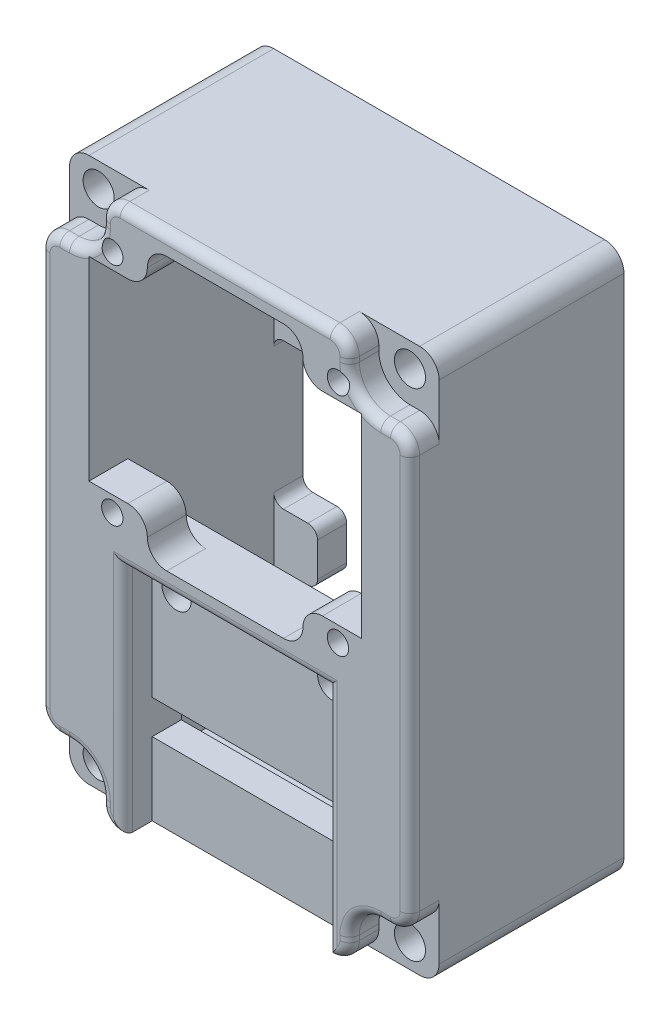
from build123d import *

# Parameters (mm, degrees)
EXTRUDE_1_DEPTH      = 22
SKETCH_2_W           = 28
SKETCH_2_H           = 20
CUT_EXTRUDE_1_DEPTH  = 50.44694126030446
CUT_EXTRUDE_4_DEPTH  = 3
CUT_EXTRUDE_5_DEPTH  = 49.187135212627034
SKETCH_7_W           = 28
SKETCH_7_H           = 28
CUT_EXTRUDE_6_DEPTH  = 18
SKETCH_8_R           = 1.6000000000000019
SKETCH_8_R_2         = 1.5999999999999974
SKETCH_8_R_3         = 1.6000000000000079
CUT_EXTRUDE_7_DEPTH  = 50.44694126030446
SKETCH_9_R           = 1.100000000000001
CUT_EXTRUDE_8_DEPTH  = 48.80167361086848
SKETCH_10_W          = 16
SKETCH_10_H          = 28
CUT_EXTRUDE_9_DEPTH  = 50.44694126030446
SKETCH_11_R          = 1.5
SKETCH_11_R_2        = 1.4999999999999991
CUT_EXTRUDE_10_DEPTH = 49.187135212627034
FILLET_1_R           = 2
FILLET_2_R           = 2
SKETCH_12_W          = 28.000000000000004
SKETCH_12_H          = 24
CUT_EXTRUDE_11_DEPTH = 16
SKETCH_13_W          = 21.000000000000018
SKETCH_13_H          = 8.455815676283699
CUT_EXTRUDE_12_DEPTH = 3
CUT_EXTRUDE_13_REACH = 65.095
CUT_EXTRUDE_14_DEPTH = 3
FILLET_4_R           = 2
FILLET_5_R           = 1
SKETCH_16_W          = 4.5
SKETCH_16_H          = 30
EXTRUDE_2_DEPTH      = 3
SKETCH_17_W          = 28.000000000000007
SKETCH_17_H          = 15
CUT_EXTRUDE_15_DEPTH = 3
FILLET_6_R           = 1


# Some blends are built 0.0001 mm under size
with BuildPart() as part:
    # 草图1 → 凸台-拉伸1 (new body)
    with BuildSketch(Plane.XY):
        Polygon((-19, 15.999999999999996), (19, 15.999999999999996), (19.000000000000007, -40), (-18.999999999999993, -40), align=None)
    extrude(amount=EXTRUDE_1_DEPTH)

    # 草图2 → 切除-拉伸1 (cut, through all)
    with BuildSketch(Plane.XY.offset(22)):
        Rectangle(SKETCH_2_W, SKETCH_2_H)
    extrude(amount=-CUT_EXTRUDE_1_DEPTH, mode=Mode.SUBTRACT)

    # 草图5 → 切除-拉伸4 (cut)
    with BuildSketch(Plane.XY.offset(22)):
        Polygon((-10.499999999999996, -16), (10.500000000000004, -16), (10.500000000000007, -32), (-10.499999999999995, -32), align=None)
    extrude(amount=-CUT_EXTRUDE_4_DEPTH, mode=Mode.SUBTRACT)

    # 草图6 → 切除-拉伸5 (cut, through all)
    with BuildSketch(Plane.XY.offset(19)):
        Polygon((-10.500000000000005, -28.999999999999996), (10.500000000000005, -28.999999999999996), (10.500000000000007, -32.5), (-10.500000000000005, -32.5), align=None)
    extrude(amount=-CUT_EXTRUDE_5_DEPTH, mode=Mode.SUBTRACT)

    # 草图7 → 切除-拉伸6 (cut)
    with BuildSketch(Plane(origin=(0, 0, 0), x_dir=(-1, 0, 0), z_dir=(0, 0, -1))):
        Rectangle(SKETCH_7_W, SKETCH_7_H)
    extrude(amount=-CUT_EXTRUDE_6_DEPTH, mode=Mode.SUBTRACT)

    # 草图8 → 切除-拉伸7 (cut, through all)
    with BuildSketch(Plane.XY.offset(22)):
        with Locations((-16.000000000000004, 13.499999999999996)):
            Circle(SKETCH_8_R)
        with Locations(Location((16.000000000000004, 13.5, 0), (0, 0, 180))):
            Circle(SKETCH_8_R)
        with Locations((16.000000000000004, -37.50000000000001)):
            Circle(SKETCH_8_R_2)
        with Locations(Location((-16.000000000000004, -37.5, 0), (0, 0, 180))):
            Circle(SKETCH_8_R_3)
    extrude(amount=-CUT_EXTRUDE_7_DEPTH, mode=Mode.SUBTRACT)

    # 草图9 → 切除-拉伸8 (cut, through all)
    with BuildSketch(Plane(origin=(0, 0, 18), x_dir=(-1, 0, 0), z_dir=(0, 0, -1))):
        with Locations((-11.6, 11.599999999999998)):
            Circle(SKETCH_9_R)
        with Locations((11.6, 11.600000000000001)):
            Circle(SKETCH_9_R)
        with Locations((11.6, -11.599999999999998)):
            Circle(SKETCH_9_R)
        with Locations((-11.6, -11.600000000000001)):
            Circle(SKETCH_9_R)
    extrude(amount=-CUT_EXTRUDE_8_DEPTH, mode=Mode.SUBTRACT)

    # 草图10 → 切除-拉伸9 (cut, through all)
    with BuildSketch(Plane.XY.offset(22)):
        Rectangle(SKETCH_10_W, SKETCH_10_H)
    extrude(amount=-CUT_EXTRUDE_9_DEPTH, mode=Mode.SUBTRACT)

    # 草图11 → 切除-拉伸10 (cut, through all)
    with BuildSketch(Plane.XY.offset(19)):
        with Locations((-7.999999999999998, -18.5)):
            Circle(SKETCH_11_R)
        with Locations(Location((8.000000000000002, -18.499999999999996, 0), (0, 0, 180))):
            Circle(SKETCH_11_R_2)
    extrude(amount=-CUT_EXTRUDE_10_DEPTH, mode=Mode.SUBTRACT)

    # 圆角1
    fillet_1_edges = [part.edges().sort_by_distance(p)[0] for p in [
        (-8, -14.000000000000002, 20),
        (8, -14.000000000000002, 20),
        (-8, 13.999999999999998, 20),
        (8, 13.999999999999998, 20),
    ]]
    fillet(fillet_1_edges, radius=FILLET_1_R)
    fillet_1_2_edges = [part.edges().sort_by_distance(p)[0] for p in [
        (-8, 10.000000000000002, 20),
        (8, 10.000000000000002, 20),
        (-8, -9.999999999999998, 20),
        (8, -9.999999999999998, 20),
    ]]
    fillet(fillet_1_2_edges, radius=FILLET_1_R - 0.0001)  # a hair under: the kernel refuses the full size

    # 圆角2
    fillet_2_edges = [part.edges().sort_by_distance(p)[0] for p in [
        (19.000000000000007, -40, 11),
        (-18.999999999999993, -40, 11),
        (-19, 15.999999999999996, 11),
        (19, 15.999999999999996, 11),
    ]]
    fillet(fillet_2_edges, radius=FILLET_2_R)

    # 草图12 → 切除-拉伸11 (cut)
    with BuildSketch(Plane(origin=(0, 0, 0), x_dir=(-1, 0, 0), z_dir=(0, 0, -1))):
        with Locations((0, -26)):
            Rectangle(SKETCH_12_W, SKETCH_12_H)
    extrude(amount=-CUT_EXTRUDE_11_DEPTH, mode=Mode.SUBTRACT)

    # 草图13 → 切除-拉伸12 (cut)
    with BuildSketch(Plane.XY.offset(22)):
        with Locations((0, -36.227907838141846)):
            Rectangle(SKETCH_13_W, SKETCH_13_H)
    extrude(amount=-CUT_EXTRUDE_12_DEPTH, mode=Mode.SUBTRACT)

    # 草图14 → 切除-拉伸13 (cut, up to next)
    with BuildSketch(Plane(origin=(0, -40, 0), x_dir=(-1, 0, 0), z_dir=(0, -1, 0)), mode=Mode.PRIVATE) as cut_extrude_13_sk1:
        Polygon((5.999999999999998, -3.9999999999999956), (-6.000000000000003, -4), (-6.000000000000002, 0), (5.999999999999998, 4e-16), align=None)
    cut_extrude_13_tool1 = extrude(cut_extrude_13_sk1.sketch, amount=-CUT_EXTRUDE_13_REACH, mode=Mode.PRIVATE) & part.part
    add(cut_extrude_13_tool1.solids().sort_by_distance((0, -40, 2))[0], mode=Mode.SUBTRACT)

    # 草图15 → 切除-拉伸14 (cut)
    with BuildSketch(Plane.XY.offset(22)):
        with BuildLine():
            Line((-12.8, 13.499999999999996), (-12.799999999999999, 15.999999999999996))
            Line((-12.799999999999999, 15.999999999999996), (-17.000000000000007, 15.999999999999996))
            ThreePointArc((-17.000000000000007, 15.999999999999996), (-18.414213562373103, 15.414213562373083), (-19, 13.999999999999982))
            Line((-19, 13.999999999999982), (-18.999999999999996, 10.299999999999969))
            Line((-18.999999999999996, 10.299999999999969), (-16.000000000000004, 10.29999999999998))
            ThreePointArc((-16.000000000000004, 10.29999999999998), (-13.737258300203038, 11.237258300203033), (-12.8, 13.499999999999996))
        make_face()
        with BuildLine():
            Line((12.8, 13.5), (12.799999999999999, 16))
            Line((12.799999999999999, 16), (17.000000000000014, 15.999999999999993))
            ThreePointArc((17.000000000000014, 15.999999999999993), (18.414213562373106, 15.414213562373082), (19.000000000000007, 13.99999999999998))
            Line((19.000000000000007, 13.99999999999998), (18.999999999999996, 10.299999999999974))
            Line((18.999999999999996, 10.299999999999974), (16.000000000000004, 10.299999999999983))
            ThreePointArc((16.000000000000004, 10.299999999999983), (13.737258300203047, 11.237258300203038), (12.8, 13.5))
        make_face()
        with BuildLine():
            Line((16.000000000000004, -34.29999999999996), (18.999999999999996, -34.299999999999955))
            Line((18.999999999999996, -34.299999999999955), (19.000000000000007, -37.999999999999964))
            ThreePointArc((19.000000000000007, -37.999999999999964), (18.414213562373106, -39.414213562373064), (17.000000000000014, -39.99999999999997))
            Line((17.000000000000014, -39.99999999999997), (12.799999999999999, -39.99999999999998))
            Line((12.799999999999999, -39.99999999999998), (12.8, -37.49999999999998))
            ThreePointArc((12.8, -37.49999999999998), (13.737258300203045, -35.23725830020302), (16.000000000000004, -34.29999999999996))
        make_face()
        with BuildLine():
            Line((-12.799999999999986, -37.49999999999998), (-12.799999999999985, -39.99999999999998))
            Line((-12.799999999999985, -39.99999999999998), (-17.000000000000007, -39.99999999999998))
            ThreePointArc((-17.000000000000007, -39.99999999999998), (-18.414213562373103, -39.414213562373064), (-19, -37.999999999999964))
            Line((-19, -37.999999999999964), (-18.999999999999982, -34.29999999999996))
            Line((-18.999999999999982, -34.29999999999996), (-15.99999999999999, -34.29999999999997))
            ThreePointArc((-15.99999999999999, -34.29999999999997), (-13.73725830020304, -35.237258300203024), (-12.799999999999986, -37.49999999999998))
        make_face()
    extrude(amount=-CUT_EXTRUDE_14_DEPTH, mode=Mode.SUBTRACT)

    # 圆角4
    fillet_4_edges = [part.edges().sort_by_distance(p)[0] for p in [
        (-12.799999999999985, -39.99999999999998, 20.5),
        (-18.999999999999982, -34.29999999999996, 20.5),
        (18.999999999999996, -34.299999999999955, 20.5),
        (12.799999999999999, -39.99999999999998, 20.5),
        (12.799999999999999, 16, 20.5),
        (18.999999999999996, 10.299999999999974, 20.5),
        (-18.999999999999996, 10.299999999999969, 20.5),
        (-12.799999999999999, 15.999999999999996, 20.5),
    ]]
    fillet(fillet_4_edges, radius=FILLET_4_R)

    # 圆角5
    # the kernel refuses this fillet: 1 mm, written as the material it takes off along each edge
    with BuildSketch(Plane(origin=(10.8, -38, 22), x_dir=(0, -1, 0), z_dir=(-1, 0, 0))) as fillet_5_piece_1:
        with BuildLine():
            CenterArc((2 - FILLET_5_R, -FILLET_5_R), FILLET_5_R, 0, 90)
            Line((2, -FILLET_5_R), (2, 0))
            Line((2, 0), (2 - FILLET_5_R, 0))
        make_face()
    revolve(axis=Axis((10.8, -38, 22), (0, 0, 1)), revolution_arc=90, mode=Mode.SUBTRACT)
    with BuildSketch(Plane(origin=(12.8, -38, 22), x_dir=(-1, 7.1e-16, 0), z_dir=(7.1e-16, 1, 0)), Plane(origin=(-12.799999999999986, -37.49999999999998, 22), x_dir=(1, 7.1e-16, 0), z_dir=(7.1e-16, -1, 0))) as fillet_5_piece_2:
        with BuildLine():
            CenterArc((FILLET_5_R, -FILLET_5_R), FILLET_5_R, 90, 90)
            Line((0, -FILLET_5_R), (0, 0))
            Line((0, 0), (FILLET_5_R, 0))
        make_face()
    extrude(amount=0.5000000000000213, mode=Mode.SUBTRACT)
    with BuildSketch(Plane(origin=(16.000000000000007, -37.49999999999997, 22), x_dir=(-1, -2.22e-15, 0), z_dir=(2.22e-15, -1, 0))) as fillet_5_piece_3:
        with BuildLine():
            CenterArc((3.200000000000008 + FILLET_5_R, FILLET_5_R), FILLET_5_R, 180, 90)
            Line((3.200000000000008, FILLET_5_R), (3.200000000000008, 0))
            Line((3.200000000000008, 0), (3.200000000000008 + FILLET_5_R, 0))
        make_face()
    revolve(axis=Axis((16.000000000000007, -37.49999999999997, 22), (0, 0, -1)), revolution_arc=90.00000000000006, mode=Mode.SUBTRACT)
    with BuildSketch(Plane(origin=(16.000000000000004, -34.29999999999996, 22), x_dir=(-2.37e-15, 1, 0), z_dir=(1, 2.37e-15, 0)), Plane(origin=(-16.999999999999996, -34.29999999999997, 22), x_dir=(2.37e-15, 1, 0), z_dir=(1, -2.37e-15, 0))) as fillet_5_piece_4:
        with BuildLine():
            CenterArc((FILLET_5_R, -FILLET_5_R), FILLET_5_R, 90, 90)
            Line((0, -FILLET_5_R), (0, 0))
            Line((0, 0), (FILLET_5_R, 0))
        make_face()
    extrude(amount=1.000000000000007, mode=Mode.SUBTRACT)
    with BuildSketch(Plane(origin=(17.000000000000007, -32.29999999999996, 22), x_dir=(1.78e-15, -1, 0), z_dir=(-1, -1.78e-15, 0))) as fillet_5_piece_5:
        with BuildLine():
            CenterArc((2 - FILLET_5_R, -FILLET_5_R), FILLET_5_R, 0, 90)
            Line((2, -FILLET_5_R), (2, 0))
            Line((2, 0), (2 - FILLET_5_R, 0))
        make_face()
    revolve(axis=Axis((17.000000000000007, -32.29999999999996, 22), (0, 0, 1)), revolution_arc=90.0000000000001, mode=Mode.SUBTRACT)
    with BuildSketch(Plane(origin=(19, 8.29999999999998, 22), x_dir=(-1, -1.3e-16, 0), z_dir=(1.3e-16, -1, 0))) as fillet_5_piece_6:
        with BuildLine():
            CenterArc((FILLET_5_R, FILLET_5_R), FILLET_5_R, 180, 90)
            Line((0, FILLET_5_R), (0, 0))
            Line((0, 0), (FILLET_5_R, 0))
        make_face()
    extrude(amount=40.59999999999994, mode=Mode.SUBTRACT)
    with BuildSketch(Plane(origin=(17, 8.29999999999998, 22), x_dir=(1, 0, 0), z_dir=(0, -1, 0))) as fillet_5_piece_7:
        with BuildLine():
            CenterArc((2 - FILLET_5_R, -FILLET_5_R), FILLET_5_R, 0, 90)
            Line((2, -FILLET_5_R), (2, 0))
            Line((2, 0), (2 - FILLET_5_R, 0))
        make_face()
    revolve(axis=Axis((17, 8.29999999999998, 22), (0, 0, 1)), revolution_arc=89.9999999999998, mode=Mode.SUBTRACT)
    with BuildSketch(Plane(origin=(17.000000000000007, 10.29999999999998, 22), x_dir=(-2.96e-15, -1, 0), z_dir=(-1, 2.96e-15, 0))) as fillet_5_piece_8:
        with BuildLine():
            CenterArc((FILLET_5_R, -FILLET_5_R), FILLET_5_R, 90, 90)
            Line((0, -FILLET_5_R), (0, 0))
            Line((0, 0), (FILLET_5_R, 0))
        make_face()
    extrude(amount=1.0000000000000036, mode=Mode.SUBTRACT)
    with BuildSketch(Plane(origin=(16.000000000000014, 13.499999999999995, 22), x_dir=(-3.33e-15, -1, 0), z_dir=(1, -3.33e-15, 0))) as fillet_5_piece_9:
        with BuildLine():
            CenterArc((3.2000000000000135 + FILLET_5_R, FILLET_5_R), FILLET_5_R, 180, 90)
            Line((3.2000000000000117, FILLET_5_R), (3.2000000000000135, 0))
            Line((3.2000000000000135, 0), (3.2000000000000135 + FILLET_5_R, 0))
        make_face()
    revolve(axis=Axis((16.000000000000014, 13.499999999999995, 22), (0, 0, -1)), revolution_arc=89.99999999999991, mode=Mode.SUBTRACT)
    with BuildSketch(Plane(origin=(12.8, 13.5, 22), x_dir=(-1, -7.1e-16, 0), z_dir=(-7.1e-16, 1, 0))) as fillet_5_piece_10:
        with BuildLine():
            CenterArc((FILLET_5_R, -FILLET_5_R), FILLET_5_R, 90, 90)
            Line((0, -FILLET_5_R), (0, 0))
            Line((0, 0), (FILLET_5_R, 0))
        make_face()
    extrude(amount=0.4999999999999982, mode=Mode.SUBTRACT)
    with BuildSketch(Plane(origin=(10.799999999999999, 13.999999999999996, 22), x_dir=(1, 1.78e-15, 0), z_dir=(1.78e-15, -1, 0))) as fillet_5_piece_11:
        with BuildLine():
            CenterArc((2 - FILLET_5_R, -FILLET_5_R), FILLET_5_R, 0, 90)
            Line((2, -FILLET_5_R), (2, 0))
            Line((2, 0), (2 - FILLET_5_R, 0))
        make_face()
    revolve(axis=Axis((10.799999999999999, 13.999999999999996, 22), (0, 0, 1)), revolution_arc=89.99999999999994, mode=Mode.SUBTRACT)
    with BuildSketch(Plane(origin=(-10.8, 15.999999999999996, 22), x_dir=(0, -1, 0), z_dir=(1, 0, 0))) as fillet_5_piece_12:
        with BuildLine():
            CenterArc((FILLET_5_R, FILLET_5_R), FILLET_5_R, 180, 90)
            Line((0, FILLET_5_R), (0, 0))
            Line((0, 0), (FILLET_5_R, 0))
        make_face()
    extrude(amount=21.599999999999998, mode=Mode.SUBTRACT)
    with BuildSketch(Plane(origin=(-10.8, 13.999999999999996, 22), x_dir=(-1, 1.78e-15, 0), z_dir=(-1.78e-15, -1, 0))) as fillet_5_piece_13:
        with BuildLine():
            CenterArc((2 - FILLET_5_R, FILLET_5_R), FILLET_5_R, 270, 90)
            Line((2, FILLET_5_R), (2, 0))
            Line((2, 0), (2 - FILLET_5_R, 0))
        make_face()
    revolve(axis=Axis((-10.8, 13.999999999999996, 22), (0, 0, -1)), revolution_arc=89.9999999999999, mode=Mode.SUBTRACT)
    with BuildSketch(Plane(origin=(-12.8, 13.499999999999996, 22), x_dir=(1, -7.1e-16, 0), z_dir=(7.1e-16, 1, 0))) as fillet_5_piece_14:
        with BuildLine():
            CenterArc((FILLET_5_R, FILLET_5_R), FILLET_5_R, 180, 90)
            Line((0, FILLET_5_R), (0, 0))
            Line((0, 0), (FILLET_5_R, 0))
        make_face()
    extrude(amount=0.5000000000000018, mode=Mode.SUBTRACT)
    with BuildSketch(Plane(origin=(-15.999999999999993, 13.499999999999972, 22), x_dir=(-3.33e-15, -1, 0), z_dir=(-1, 3.33e-15, 0))) as fillet_5_piece_15:
        with BuildLine():
            CenterArc((3.199999999999992 + FILLET_5_R, -FILLET_5_R), FILLET_5_R, 90, 90)
            Line((3.199999999999992, -FILLET_5_R), (3.199999999999992, 0))
            Line((3.199999999999992, 0), (3.199999999999992 + FILLET_5_R, 0))
        make_face()
    revolve(axis=Axis((-15.999999999999993, 13.499999999999972, 22), (0, 0, 1)), revolution_arc=90.00000000000064, mode=Mode.SUBTRACT)
    with BuildSketch(Plane(origin=(-17.000000000000007, 10.299999999999976, 22), x_dir=(3.55e-15, -1, 0), z_dir=(1, 3.55e-15, 0))) as fillet_5_piece_16:
        with BuildLine():
            CenterArc((FILLET_5_R, FILLET_5_R), FILLET_5_R, 180, 90)
            Line((0, FILLET_5_R), (0, 0))
            Line((0, 0), (FILLET_5_R, 0))
        make_face()
    extrude(amount=1.0000000000000036, mode=Mode.SUBTRACT)
    with BuildSketch(Plane(origin=(-17, 8.299999999999976, 22), x_dir=(-3.55e-15, 1, 0), z_dir=(1, 3.55e-15, 0))) as fillet_5_piece_17:
        with BuildLine():
            CenterArc((2 - FILLET_5_R, -FILLET_5_R), FILLET_5_R, 0, 90)
            Line((2, -FILLET_5_R), (2, 0))
            Line((2, 0), (2 - FILLET_5_R, 0))
        make_face()
    revolve(axis=Axis((-17, 8.299999999999976, 22), (0, 0, 1)), revolution_arc=89.9999999999998, mode=Mode.SUBTRACT)
    with BuildSketch(Plane(origin=(-10.799999999999985, -38, 22), x_dir=(-1, 0, 0), z_dir=(0, 1, 0))) as fillet_5_piece_18:
        with BuildLine():
            CenterArc((2 - FILLET_5_R, -FILLET_5_R), FILLET_5_R, 0, 90)
            Line((2, -FILLET_5_R), (2, 0))
            Line((2, 0), (2 - FILLET_5_R, 0))
        make_face()
    revolve(axis=Axis((-10.799999999999985, -38, 22), (0, 0, 1)), revolution_arc=90.00000000000006, mode=Mode.SUBTRACT)
    with BuildSketch(Plane(origin=(-16.000000000000007, -37.499999999999986, 22), x_dir=(5.55e-15, 1, 0), z_dir=(-1, 5.55e-15, 0))) as fillet_5_piece_19:
        with BuildLine():
            CenterArc((3.200000000000017 + FILLET_5_R, FILLET_5_R), FILLET_5_R, 180, 90)
            Line((3.200000000000017, FILLET_5_R), (3.200000000000017, 0))
            Line((3.200000000000017, 0), (3.200000000000017 + FILLET_5_R, 0))
        make_face()
    revolve(axis=Axis((-16.000000000000007, -37.499999999999986, 22), (0, 0, -1)), revolution_arc=89.99999999999956, mode=Mode.SUBTRACT)
    with BuildSketch(Plane(origin=(-16.999999999999993, -32.29999999999997, 22), x_dir=(-1, 0, 0), z_dir=(0, 1, 0))) as fillet_5_piece_20:
        with BuildLine():
            CenterArc((2 - FILLET_5_R, -FILLET_5_R), FILLET_5_R, 0, 90)
            Line((2, -FILLET_5_R), (2, 0))
            Line((2, 0), (2 - FILLET_5_R, 0))
        make_face()
    revolve(axis=Axis((-16.999999999999993, -32.29999999999997, 22), (0, 0, 1)), revolution_arc=89.9999999999999, mode=Mode.SUBTRACT)
    with BuildSketch(Plane(origin=(10.500000000000004, -16, 22), x_dir=(1, 2.2e-16, 0), z_dir=(2.2e-16, -1, 0)), Plane(origin=(-10.500000000000009, -42.5, 22), x_dir=(-1, 4.4e-16, 0), z_dir=(4.4e-16, 1, 0))) as fillet_5_piece_21:
        with BuildLine():
            CenterArc((FILLET_5_R, -FILLET_5_R), FILLET_5_R, 90, 90)
            Line((0, -FILLET_5_R), (0, 0))
            Line((0, 0), (FILLET_5_R, 0))
        make_face()
    extrude(amount=26.5, mode=Mode.SUBTRACT)
    with BuildSketch(Plane(origin=(-10.499999999999996, -16, 22), x_dir=(0, 1, 0), z_dir=(1, 0, 0))) as fillet_5_piece_22:
        with BuildLine():
            CenterArc((FILLET_5_R, -FILLET_5_R), FILLET_5_R, 90, 90)
            Line((0, -FILLET_5_R), (0, 0))
            Line((0, 0), (FILLET_5_R, 0))
        make_face()
    extrude(amount=21, mode=Mode.SUBTRACT)
    with BuildSketch(Plane(origin=(-18.999999999999993, -32.29999999999997, 22), x_dir=(1, 1.3e-16, 0), z_dir=(-1.3e-16, 1, 0))) as fillet_5_piece_23:
        with BuildLine():
            CenterArc((FILLET_5_R, FILLET_5_R), FILLET_5_R, 180, 90)
            Line((0, FILLET_5_R), (0, 0))
            Line((0, 0), (FILLET_5_R, 0))
        make_face()
    extrude(amount=40.599999999999945, mode=Mode.SUBTRACT)
    with BuildSketch(Plane(origin=(-8.000000000000007, -40, 22), x_dir=(0, 1, 0), z_dir=(-1, 0, 0))) as fillet_5_piece_24:
        with BuildLine():
            CenterArc((FILLET_5_R, FILLET_5_R), FILLET_5_R, 180, 90)
            Line((0, FILLET_5_R), (0, 0))
            Line((0, 0), (FILLET_5_R, 0))
        make_face()
    extrude(amount=2.799999999999976, mode=Mode.SUBTRACT)
    with BuildSketch(Plane(origin=(10.8, -40, 22), x_dir=(0, 1, 0), z_dir=(-1, 0, 0))) as fillet_5_piece_25:
        with BuildLine():
            CenterArc((FILLET_5_R, FILLET_5_R), FILLET_5_R, 180, 90)
            Line((0, FILLET_5_R), (0, 0))
            Line((0, 0), (FILLET_5_R, 0))
        make_face()
    extrude(amount=2.799999999999992, mode=Mode.SUBTRACT)
    with BuildSketch(Plane(origin=(-10.499999999999996, -16, 22), x_dir=(0, 1, 0), z_dir=(1, 0, 0))) as fillet_5_piece_26a_section:
        with BuildLine():
            CenterArc((FILLET_5_R, -FILLET_5_R), FILLET_5_R, 90, 90)
            Line((0, -FILLET_5_R), (0, 0))
            Line((0, 0), (FILLET_5_R, 0))
        make_face()
    fillet_5_piece_26a = extrude(amount=23.5, mode=Mode.PRIVATE)
    fillet_5_piece_26a = split(fillet_5_piece_26a, bisect_by=Plane(origin=(10.499999999999998, -15.773604885733173, 21.77360488573317), z_dir=(1, 5.1e-16, 0)), keep=Keep.TOP, mode=Mode.PRIVATE)
    with BuildSketch(Plane(origin=(10.499999999999998, -13.5, 22), x_dir=(1, 2.2e-16, 0), z_dir=(2.2e-16, -1, 0))) as fillet_5_piece_26b_section:
        with BuildLine():
            CenterArc((FILLET_5_R, -FILLET_5_R), FILLET_5_R, 90, 90)
            Line((0, -FILLET_5_R), (0, 0))
            Line((0, 0), (FILLET_5_R, 0))
        make_face()
    fillet_5_piece_26b = extrude(amount=29, mode=Mode.PRIVATE)
    fillet_5_piece_26b = split(fillet_5_piece_26b, bisect_by=Plane(origin=(10.726395114266825, -16, 21.773604885733175), z_dir=(0, 1, 0)), keep=Keep.TOP, mode=Mode.PRIVATE)
    fillet_5_piece_26 = fillet_5_piece_26a & fillet_5_piece_26b
    add(fillet_5_piece_26, mode=Mode.SUBTRACT)
    with BuildSketch(Plane(origin=(-10.500000000000009, -42.5, 22), x_dir=(-1, 4.4e-16, 0), z_dir=(4.4e-16, 1, 0))) as fillet_5_piece_27a_section:
        with BuildLine():
            CenterArc((FILLET_5_R, -FILLET_5_R), FILLET_5_R, 90, 90)
            Line((0, -FILLET_5_R), (0, 0))
            Line((0, 0), (FILLET_5_R, 0))
        make_face()
    fillet_5_piece_27a = extrude(amount=29, mode=Mode.PRIVATE)
    fillet_5_piece_27a = split(fillet_5_piece_27a, bisect_by=Plane(origin=(-10.726395114266822, -16, 21.773604885733175), z_dir=(0, 1, 0)), keep=Keep.TOP, mode=Mode.PRIVATE)
    with BuildSketch(Plane(origin=(-12.999999999999996, -16, 22), x_dir=(0, 1, 0), z_dir=(1, 0, 0))) as fillet_5_piece_27b_section:
        with BuildLine():
            CenterArc((FILLET_5_R, -FILLET_5_R), FILLET_5_R, 90, 90)
            Line((0, -FILLET_5_R), (0, 0))
            Line((0, 0), (FILLET_5_R, 0))
        make_face()
    fillet_5_piece_27b = extrude(amount=23.5, mode=Mode.PRIVATE)
    fillet_5_piece_27b = split(fillet_5_piece_27b, bisect_by=Plane(origin=(-10.500000000000009, -15.773604885733171, 21.773604885733175), z_dir=(-1, 0, 0)), keep=Keep.TOP, mode=Mode.PRIVATE)
    fillet_5_piece_27 = fillet_5_piece_27a & fillet_5_piece_27b
    add(fillet_5_piece_27, mode=Mode.SUBTRACT)

    # 草图16 → 凸台-拉伸2 (add)
    with BuildSketch(Plane(origin=(0, 0, 0), x_dir=(-1, 0, 0), z_dir=(0, 0, -1))):
        with Locations((-11.750000000000002, -12.000000000000007)):
            Rectangle(SKETCH_16_W, SKETCH_16_H)
        Polygon((9.500000000000005, 2.9999999999999956), (14.000000000000004, 2.9999999999999964), (14.00000000000001, -27.000000000000004), (9.500000000000012, -27.000000000000004), align=None)
    extrude(amount=-EXTRUDE_2_DEPTH)

    # 草图17 → 切除-拉伸15 (cut)
    with BuildSketch(Plane(origin=(0, 0, 0), x_dir=(-1, 0, 0), z_dir=(0, 0, -1))):
        with Locations((-8.9e-16, -13.999999999999996)):
            Rectangle(SKETCH_17_W, SKETCH_17_H)
    extrude(amount=-CUT_EXTRUDE_15_DEPTH, mode=Mode.SUBTRACT)

    # 圆角6
    fillet_6_edges = [part.edges().sort_by_distance(p)[0] for p in [
        (14, -27.000000000000007, 1.5),
        (14, 2.9999999999999933, 1.5),
        (9.500000000000002, 2.9999999999999933, 1.5),
        (9.500000000000002, -27.000000000000007, 1.5),
        (-9.500000000000012, -27.000000000000004, 1.5),
        (-9.500000000000005, 2.9999999999999956, 1.5),
        (-14.000000000000004, 2.9999999999999964, 1.5),
        (-14.00000000000001, -27.000000000000004, 1.5),
        (9.500000000000002, -21.499999999999996, 1.5),
        (-9.50000000000001, -21.499999999999996, 1.5),
        (9.5, -6.4999999999999964, 1.5),
        (-9.500000000000007, -6.4999999999999964, 1.5),
        (14.000000000000004, -6.499999999999996, 1.5),
        (-14, -6.499999999999996, 1.5),
        (-14, -21.499999999999996, 1.5),
        (14.000000000000004, -21.499999999999996, 1.5),
    ]]
    fillet(fillet_6_edges, radius=FILLET_6_R)


solid = part.part
